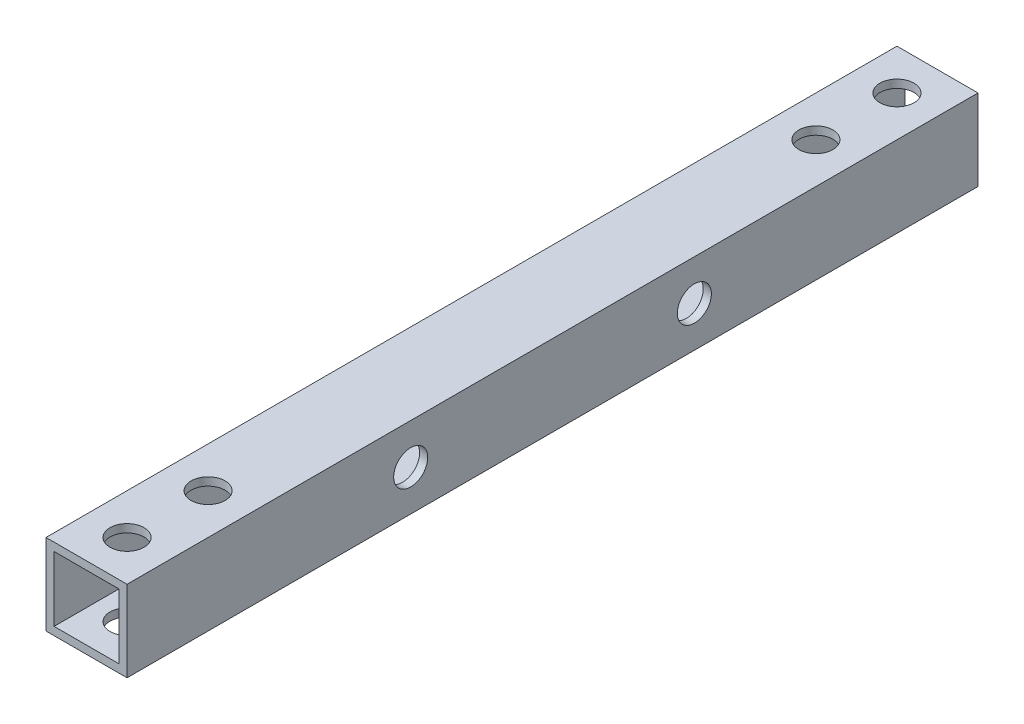
from build123d import *

# Parameters (mm, degrees)
SKETCH1_W           = 10
SKETCH1_H           = 10
SKETCH1_W_2         = 8
SKETCH1_H_2         = 8
BOSS_EXTRUDE1_DEPTH = 105
SKETCH2_R           = 2.1
CUT_EXTRUDE1_DEPTH  = 116
SKETCH4_R           = 2.1
CUT_EXTRUDE3_DEPTH  = 10


with BuildPart() as part:
    # Sketch1 → Boss-Extrude1 (new body)
    with BuildSketch(Plane.XY):
        with Locations((5, 5)):
            Rectangle(SKETCH1_W, SKETCH1_H)
        with Locations((5, 5)):
            Rectangle(SKETCH1_W_2, SKETCH1_H_2, mode=Mode.SUBTRACT)
    extrude(amount=BOSS_EXTRUDE1_DEPTH)

    # Sketch2 → Cut-Extrude1 (cut)
    with BuildSketch(Plane(origin=(0, 10, 0), x_dir=(1, 0, 0), z_dir=(0, 1, 0))):
        with Locations((5, -5)):
            Circle(SKETCH2_R)
        with Locations((5, -15)):
            Circle(SKETCH2_R)
        with Locations((5, -100)):
            Circle(SKETCH2_R)
        with Locations((5, -90)):
            Circle(SKETCH2_R)
    extrude(amount=-CUT_EXTRUDE1_DEPTH, mode=Mode.SUBTRACT)

    # Sketch4 → Cut-Extrude3 (cut)
    with BuildSketch(Plane(origin=(10, 0, 0), x_dir=(0, 0, -1), z_dir=(1, 0, 0))):
        with Locations((-70, 5)):
            Circle(SKETCH4_R)
        with Locations((-35, 5)):
            Circle(SKETCH4_R)
    extrude(amount=-CUT_EXTRUDE3_DEPTH, mode=Mode.SUBTRACT)


solid = part.part
